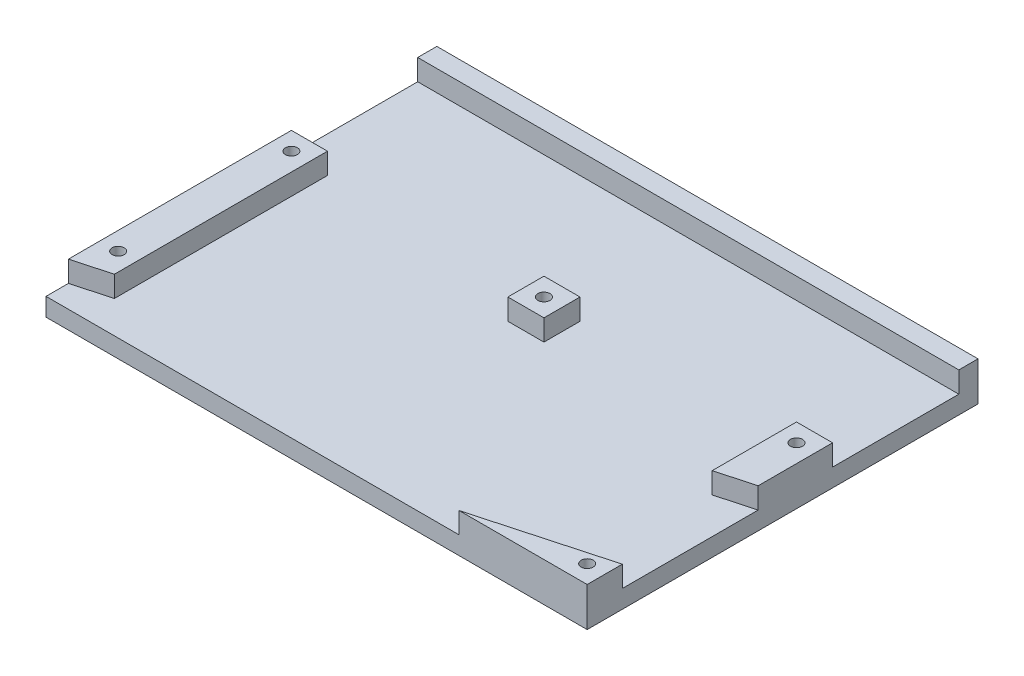
from build123d import *

# Parameters (mm, degrees)
SKETCH1_W           = 90
SKETCH1_H           = 65
BOSS_EXTRUDE1_DEPTH = 3
SKETCH2_W           = 90
SKETCH2_H           = 3.187087834
SKETCH2_W_2         = 6
SKETCH2_H_2         = 6
BOSS_EXTRUDE2_DEPTH = 3.5
SKETCH3_R           = 1
CUT_EXTRUDE1_DEPTH  = 14.5


with BuildPart() as part:
    # Sketch1 → Boss-Extrude1 (new body)
    with BuildSketch(Plane(origin=(0, 0, 0), x_dir=(1, 0, 0), z_dir=(0, 1, 0))):
        with Locations((45, 32.5)):
            Rectangle(SKETCH1_W, SKETCH1_H)
    extrude(amount=BOSS_EXTRUDE1_DEPTH)

    # Sketch2 → Boss-Extrude2 (add)
    with BuildSketch(Plane(origin=(0, 3, 0), x_dir=(1, 0, 0), z_dir=(0, 1, 0))):
        with Locations((45, 63.406456083)):
            Rectangle(SKETCH2_W, SKETCH2_H)
        Polygon((0, 40.812912166), (6, 40.812912166), (6, 5.373702529), (4, 4.824577906), (0, 3.72632866), align=None)
        Polygon((90, 40.812912166), (84, 40.812912166), (84, 26.789562822), (86, 27.338687445), (90, 28.436936691), align=None)
        with Locations((45, 37.812912166)):
            Rectangle(SKETCH2_W_2, SKETCH2_H_2)
        Polygon((68.697463874, 0), (90, 5.848873559), (90, 0), align=None)
    extrude(amount=BOSS_EXTRUDE2_DEPTH)

    # Sketch3 → Cut-Extrude1 (cut)
    with BuildSketch(Plane(origin=(0, 6.5, 0), x_dir=(1, 0, 0), z_dir=(0, 1, 0))):
        with Locations((45, 37.812912166)):
            Circle(SKETCH3_R)
        with Locations((3, 37.812912166)):
            Circle(SKETCH3_R)
        with Locations((3, 9)):
            Circle(SKETCH3_R)
        with Locations((87, 37.812912166)):
            Circle(SKETCH3_R)
        with Locations((87, 3)):
            Circle(SKETCH3_R)
    extrude(amount=-CUT_EXTRUDE1_DEPTH, mode=Mode.SUBTRACT)


solid = part.part
